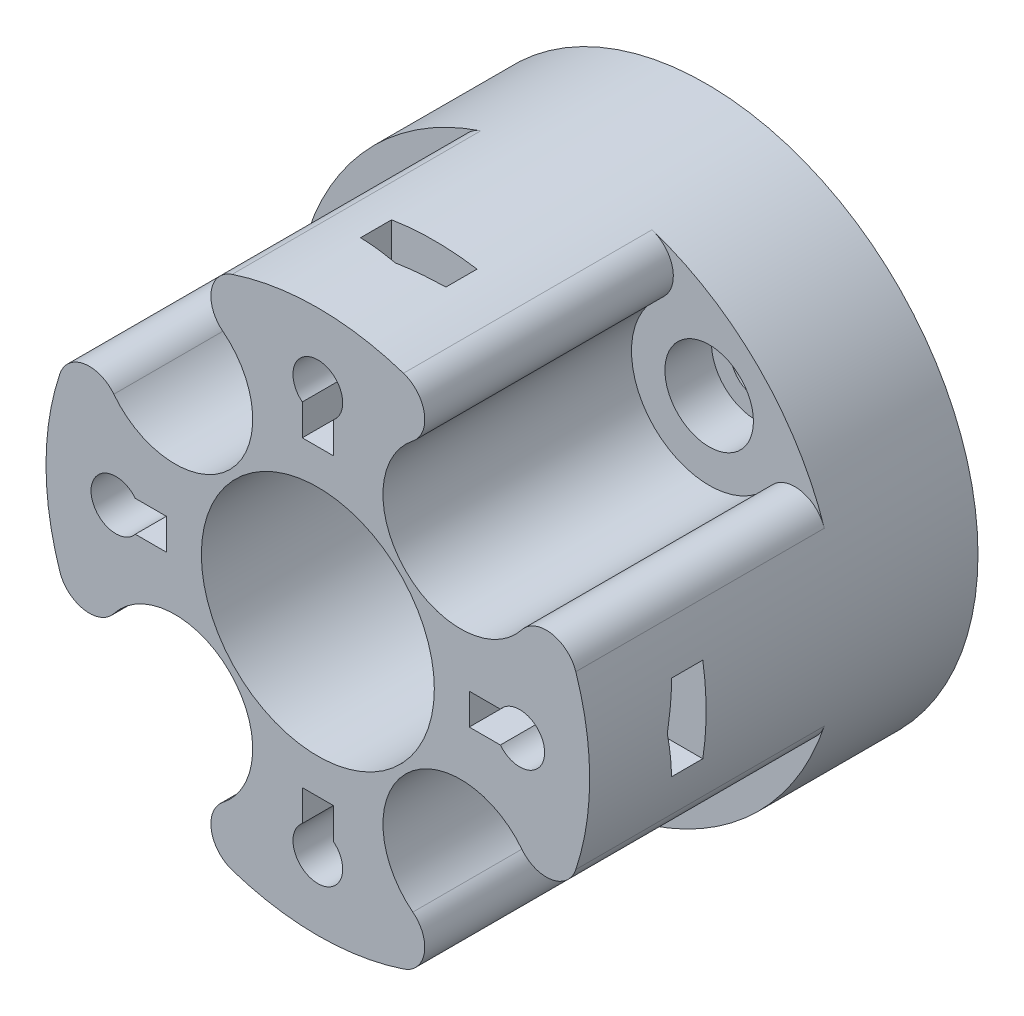
from build123d import *

# Parameters (mm, degrees)
SKETCH1_R           = 17.5
SKETCH1_R_2         = 2.85
BOSS_EXTRUDE1_DEPTH = 25
SKETCH1_3_R         = 2.85
SKETCH1_3_R_2       = 1.6
BOSS_EXTRUDE2_DEPTH = 6
SKETCH2_R           = 5
CUT_EXTRUDE1_DEPTH  = 16
FILLET1_R           = 2
CUT_EXTRUDE2_START  = -7.5
SKETCH3_R           = 1.6
CUT_EXTRUDE2_DEPTH  = 2.5
CUT_EXTRUDE3_START  = -10
SKETCH3_2_R         = 1.6
CUT_EXTRUDE3_DEPTH  = 10
CHAMFER1_SIZE       = 2.75
CHAMFER1_SIZE_2     = 0.5
SKETCH4_R           = 7.5
CUT_EXTRUDE4_DEPTH  = 36.178118369
CUT_EXTRUDE5_REACH  = 37.178
SKETCH5_W           = 2
SKETCH5_H           = 0.5
CIRPATTERN1_COUNT   = 4


with BuildPart() as part:
    # Sketch1 → Boss-Extrude1 (new body)
    with BuildSketch(Plane(origin=(0, 0, 0), x_dir=(0, 1, 0), z_dir=(0, 0, 1))):
        with Locations(Location((0, 0, 0), (0, 0, 270))):
            Circle(SKETCH1_R)
        with Locations(Location((-9.192388155, 9.192388155, 0), (0, 0, 270))):
            Circle(SKETCH1_R_2, mode=Mode.SUBTRACT)
        with Locations(Location((-9.192388155, -9.192388155, 0), (0, 0, 270))):
            Circle(SKETCH1_R_2, mode=Mode.SUBTRACT)
        with Locations(Location((9.192388155, -9.192388155, 0), (0, 0, 270))):
            Circle(SKETCH1_R_2, mode=Mode.SUBTRACT)
        with Locations(Location((9.192388155, 9.192388155, 0), (0, 0, 270))):
            Circle(SKETCH1_R_2, mode=Mode.SUBTRACT)
    extrude(amount=BOSS_EXTRUDE1_DEPTH)

    # Sketch1<3> → Boss-Extrude2 (add)
    # profile 1 of 4: a face of its own
    with BuildSketch(Plane(origin=(0, 0, 0), x_dir=(0, 1, 0), z_dir=(0, 0, 1))):
        with Locations(Location((-9.192388155, -9.192388155, 0), (0, 0, 270))):
            Circle(SKETCH1_3_R)
        with Locations(Location((-9.192388155, -9.192388155, 0), (0, 0, 270))):
            Circle(SKETCH1_3_R_2, mode=Mode.SUBTRACT)
    # profile 2 of 4: a face of its own
    with BuildSketch(Plane(origin=(0, 0, 0), x_dir=(0, 1, 0), z_dir=(0, 0, 1))):
        with Locations(Location((-9.192388155, 9.192388155, 0), (0, 0, 270))):
            Circle(SKETCH1_3_R)
        with Locations(Location((-9.192388155, 9.192388155, 0), (0, 0, 270))):
            Circle(SKETCH1_3_R_2, mode=Mode.SUBTRACT)
    # profile 3 of 4: a face of its own
    with BuildSketch(Plane(origin=(0, 0, 0), x_dir=(0, 1, 0), z_dir=(0, 0, 1))):
        with Locations(Location((9.192388155, -9.192388155, 0), (0, 0, 270))):
            Circle(SKETCH1_3_R)
        with Locations(Location((9.192388155, -9.192388155, 0), (0, 0, 270))):
            Circle(SKETCH1_3_R_2, mode=Mode.SUBTRACT)
    # profile 4 of 4: a face of its own
    with BuildSketch(Plane(origin=(0, 0, 0), x_dir=(0, 1, 0), z_dir=(0, 0, 1))):
        with Locations(Location((9.192388155, 9.192388155, 0), (0, 0, 270))):
            Circle(SKETCH1_3_R)
        with Locations(Location((9.192388155, 9.192388155, 0), (0, 0, 270))):
            Circle(SKETCH1_3_R_2, mode=Mode.SUBTRACT)
    extrude(amount=BOSS_EXTRUDE2_DEPTH)

    # Sketch2 → Cut-Extrude1 (cut)
    with BuildSketch(Plane.XY.offset(25)):
        with Locations((-9.192388155, 9.192388155)):
            Circle(SKETCH2_R)
        with Locations((9.192388155, 9.192388155)):
            Circle(SKETCH2_R)
        with Locations((9.192388155, -9.192388155)):
            Circle(SKETCH2_R)
        with Locations((-9.192388155, -9.192388155)):
            Circle(SKETCH2_R)
    extrude(amount=-CUT_EXTRUDE1_DEPTH, mode=Mode.SUBTRACT)

    # Fillet1
    fillet1_edges = [part.edges().sort_by_distance(p)[0] for p in [
        (-14.028560913, -10.46181049, 17),
        (-10.46181049, -14.028560913, 17),
        (10.46181049, -14.028560913, 17),
        (14.028560913, -10.46181049, 17),
        (14.028560913, 10.46181049, 17),
        (10.46181049, 14.028560913, 17),
        (-10.46181049, 14.028560913, 17),
        (-14.028560913, 10.46181049, 17),
    ]]
    fillet(fillet1_edges, radius=FILLET1_R)

    # Sketch3 → Cut-Extrude2 (cut)
    # profile 1 of 4: a face of its own
    with BuildSketch(Plane.XY.offset(25).offset(CUT_EXTRUDE2_START)):
        with BuildLine():
            Line((-2.75, 15.75), (-2.75, 17.282577933))
            ThreePointArc((-2.75, 17.282577933), (0, 17.5), (2.75, 17.282577933))
            Line((2.75, 17.282577933), (2.75, 15.75))
            Line((2.75, 15.75), (2.75, 10.25))
            Line((2.75, 10.25), (-2.75, 10.25))
            Line((-2.75, 10.25), (-2.75, 15.75))
        make_face()
        with Locations((0, 13)):
            Circle(SKETCH3_R, mode=Mode.SUBTRACT)
    # profile 2 of 4: a face of its own
    with BuildSketch(Plane.XY.offset(25).offset(CUT_EXTRUDE2_START)):
        with BuildLine():
            Line((15.75, -2.75), (10.25, -2.75))
            Line((10.25, -2.75), (10.25, 2.75))
            Line((10.25, 2.75), (15.75, 2.75))
            Line((15.75, 2.75), (17.282577933, 2.75))
            ThreePointArc((17.282577933, 2.75), (17.5, 0), (17.282577933, -2.75))
            Line((17.282577933, -2.75), (15.75, -2.75))
        make_face()
        with Locations((13, 0)):
            Circle(SKETCH3_R, mode=Mode.SUBTRACT)
    # profile 3 of 4: a face of its own
    with BuildSketch(Plane.XY.offset(25).offset(CUT_EXTRUDE2_START)):
        with BuildLine():
            Line((-2.75, -15.75), (-2.75, -10.25))
            Line((-2.75, -10.25), (2.75, -10.25))
            Line((2.75, -10.25), (2.75, -15.75))
            Line((2.75, -15.75), (2.75, -17.282577933))
            ThreePointArc((2.75, -17.282577933), (0, -17.5), (-2.75, -17.282577933))
            Line((-2.75, -17.282577933), (-2.75, -15.75))
        make_face()
        with Locations((0, -13)):
            Circle(SKETCH3_R, mode=Mode.SUBTRACT)
    # profile 4 of 4: a face of its own
    with BuildSketch(Plane.XY.offset(25).offset(CUT_EXTRUDE2_START)):
        with BuildLine():
            Line((-15.75, 2.75), (-10.25, 2.75))
            Line((-10.25, 2.75), (-10.25, -2.75))
            Line((-10.25, -2.75), (-15.75, -2.75))
            Line((-15.75, -2.75), (-17.282577933, -2.75))
            ThreePointArc((-17.282577933, -2.75), (-17.5, 0), (-17.282577933, 2.75))
            Line((-17.282577933, 2.75), (-15.75, 2.75))
        make_face()
        with Locations((-13, 0)):
            Circle(SKETCH3_R, mode=Mode.SUBTRACT)
    extrude(amount=CUT_EXTRUDE2_DEPTH, mode=Mode.SUBTRACT)

    # Sketch3<2> → Cut-Extrude3 (cut)
    with BuildSketch(Plane.XY.offset(25).offset(CUT_EXTRUDE3_START)):
        with Locations((-13, 0)):
            Circle(SKETCH3_2_R)
        with Locations((0, 13)):
            Circle(SKETCH3_2_R)
        with Locations((13, 0)):
            Circle(SKETCH3_2_R)
        with Locations((0, -13)):
            Circle(SKETCH3_2_R)
    extrude(amount=CUT_EXTRUDE3_DEPTH, mode=Mode.SUBTRACT)

    # Chamfer1
    # the kernel refuses this chamfer: 2.75, 0.5 mm, written as the material it adds along each edge
    with BuildSketch(Plane(origin=(-3.104266441, -2.75, 20), x_dir=(1.0355932807417332e-14, 0.9999763028084744, 0.006884317068104265), z_dir=(-1, 0, 0))) as chamfer1_piece_1_section:
        Polygon((CHAMFER1_SIZE * 0.999976302808, CHAMFER1_SIZE * 0.0068843170681), (-CHAMFER1_SIZE_2 * 0.0068843170681, CHAMFER1_SIZE_2 * 0.999976302808), (0, 0), align=None)
    chamfer1_piece_1 = extrude(amount=21.324045051, mode=Mode.PRIVATE)
    chamfer1_piece_1 = chamfer1_piece_1 & Plane(origin=(0, 0, 19.863927103), x_dir=(1, 0, 0), z_dir=(0, 0, -1)) * Cylinder(17.5, 54, mode=Mode.PRIVATE)
    chamfer1_piece_1 = chamfer1_piece_1 - Plane(origin=(-13, 0, 19.863927103), x_dir=(1, 0, 0), z_dir=(0, 0, -1)) * Cylinder(1.6, 54, mode=Mode.PRIVATE)
    add(chamfer1_piece_1)
    with BuildSketch(Plane(origin=(-24.428311492, 2.75, 20), x_dir=(2.1371797081769355e-15, 0.20388124945923355, -0.9789956262001082), z_dir=(1, 0, 0))) as chamfer1_piece_2_section:
        Polygon((CHAMFER1_SIZE_2 * 0.9789956262, -CHAMFER1_SIZE_2 * 0.203881249459), (-CHAMFER1_SIZE * 0.203881249459, -CHAMFER1_SIZE * 0.9789956262), (0, 0), align=None)
    chamfer1_piece_2 = extrude(amount=21.324045051, mode=Mode.PRIVATE)
    chamfer1_piece_2 = chamfer1_piece_2 & Plane(origin=(0, 0, 19.852070676), x_dir=(1, 0, 0), z_dir=(0, 0, -1)) * Cylinder(17.5, 54, mode=Mode.PRIVATE)
    chamfer1_piece_2 = chamfer1_piece_2 - Plane(origin=(-13, 0, 19.852070676), x_dir=(1, 0, 0), z_dir=(0, 0, -1)) * Cylinder(1.6, 54, mode=Mode.PRIVATE)
    add(chamfer1_piece_2)
    with BuildSketch(Plane(origin=(-2.75, 3.104266441, 20), x_dir=(0.9999763028084744, 0, 0.006884317068104265), z_dir=(0, 1, 0))) as chamfer1_piece_3_section:
        Polygon((CHAMFER1_SIZE * 0.999976302808, CHAMFER1_SIZE * 0.0068843170681), (-CHAMFER1_SIZE_2 * 0.0068843170681, CHAMFER1_SIZE_2 * 0.999976302808), (0, 0), align=None)
    chamfer1_piece_3 = extrude(amount=21.324045051, mode=Mode.PRIVATE)
    chamfer1_piece_3 = chamfer1_piece_3 & Plane(origin=(0, 0, 19.863927103), x_dir=(1, 0, 0), z_dir=(0, 0, -1)) * Cylinder(17.5, 54, mode=Mode.PRIVATE)
    chamfer1_piece_3 = chamfer1_piece_3 - Plane(origin=(0, 13, 19.863927103), x_dir=(1, 0, 0), z_dir=(0, 0, -1)) * Cylinder(1.6, 54, mode=Mode.PRIVATE)
    add(chamfer1_piece_3)
    with BuildSketch(Plane(origin=(2.75, 24.428311492, 20), x_dir=(0.20388124945923355, 0, -0.9789956262001082), z_dir=(0, -1, 0))) as chamfer1_piece_4_section:
        Polygon((CHAMFER1_SIZE_2 * 0.9789956262, -CHAMFER1_SIZE_2 * 0.203881249459), (-CHAMFER1_SIZE * 0.203881249459, -CHAMFER1_SIZE * 0.9789956262), (0, 0), align=None)
    chamfer1_piece_4 = extrude(amount=21.324045051, mode=Mode.PRIVATE)
    chamfer1_piece_4 = chamfer1_piece_4 & Plane(origin=(0, 0, 19.852070749), x_dir=(1, 0, 0), z_dir=(0, 0, -1)) * Cylinder(17.5, 54, mode=Mode.PRIVATE)
    chamfer1_piece_4 = chamfer1_piece_4 - Plane(origin=(0, 13, 19.852070749), x_dir=(1, 0, 0), z_dir=(0, 0, -1)) * Cylinder(1.6, 54, mode=Mode.PRIVATE)
    add(chamfer1_piece_4)
    with BuildSketch(Plane(origin=(3.104266441, 2.75, 20), x_dir=(-3.409880314637416e-15, -0.9999763028084744, 0.006884317068104265), z_dir=(1, 0, 0))) as chamfer1_piece_5_section:
        Polygon((CHAMFER1_SIZE * 0.999976302808, CHAMFER1_SIZE * 0.0068843170681), (-CHAMFER1_SIZE_2 * 0.0068843170681, CHAMFER1_SIZE_2 * 0.999976302808), (0, 0), align=None)
    chamfer1_piece_5 = extrude(amount=21.324045051, mode=Mode.PRIVATE)
    chamfer1_piece_5 = chamfer1_piece_5 & Plane(origin=(0, 0, 19.863927103), x_dir=(1, 0, 0), z_dir=(0, 0, -1)) * Cylinder(17.5, 54, mode=Mode.PRIVATE)
    chamfer1_piece_5 = chamfer1_piece_5 - Plane(origin=(13, 0, 19.863927103), x_dir=(1, 0, 0), z_dir=(0, 0, -1)) * Cylinder(1.6, 54, mode=Mode.PRIVATE)
    add(chamfer1_piece_5)
    with BuildSketch(Plane(origin=(24.428311492, -2.75, 20), x_dir=(3.409880314637416e-15, 0.9999763028084744, 0.006884317068104265), z_dir=(-1, 0, 0))) as chamfer1_piece_6_section:
        Polygon((CHAMFER1_SIZE * 0.999976302808, CHAMFER1_SIZE * 0.0068843170681), (-CHAMFER1_SIZE_2 * 0.0068843170681, CHAMFER1_SIZE_2 * 0.999976302808), (0, 0), align=None)
    chamfer1_piece_6 = extrude(amount=21.324045051, mode=Mode.PRIVATE)
    chamfer1_piece_6 = chamfer1_piece_6 & Plane(origin=(0, 0, 19.852070366), x_dir=(1, 0, 0), z_dir=(0, 0, -1)) * Cylinder(17.5, 54, mode=Mode.PRIVATE)
    chamfer1_piece_6 = chamfer1_piece_6 - Plane(origin=(13, 0, 19.852070366), x_dir=(1, 0, 0), z_dir=(0, 0, -1)) * Cylinder(1.6, 54, mode=Mode.PRIVATE)
    add(chamfer1_piece_6)
    with BuildSketch(Plane(origin=(2.75, -3.104266441, 20), x_dir=(-0.9999763028084744, 6.88290656102737e-15, 0.006884317068104265), z_dir=(0, -1, 0))) as chamfer1_piece_7_section:
        Polygon((CHAMFER1_SIZE * 0.999976302808, CHAMFER1_SIZE * 0.0068843170681), (-CHAMFER1_SIZE_2 * 0.0068843170681, CHAMFER1_SIZE_2 * 0.999976302808), (0, 0), align=None)
    chamfer1_piece_7 = extrude(amount=21.324045051, mode=Mode.PRIVATE)
    chamfer1_piece_7 = chamfer1_piece_7 & Plane(origin=(0, 0, 19.863927103), x_dir=(1, 0, 0), z_dir=(0, 0, -1)) * Cylinder(17.5, 54, mode=Mode.PRIVATE)
    chamfer1_piece_7 = chamfer1_piece_7 - Plane(origin=(0, -13, 19.863927103), x_dir=(1, 0, 0), z_dir=(0, 0, -1)) * Cylinder(1.6, 54, mode=Mode.PRIVATE)
    add(chamfer1_piece_7)
    with BuildSketch(Plane(origin=(-2.75, -24.428311492, 20), x_dir=(-0.20388124945923355, 1.4290779976363847e-15, -0.9789956262001082), z_dir=(0, 1, 0))) as chamfer1_piece_8_section:
        Polygon((CHAMFER1_SIZE_2 * 0.9789956262, -CHAMFER1_SIZE_2 * 0.203881249459), (-CHAMFER1_SIZE * 0.203881249459, -CHAMFER1_SIZE * 0.9789956262), (0, 0), align=None)
    chamfer1_piece_8 = extrude(amount=21.324045051, mode=Mode.PRIVATE)
    chamfer1_piece_8 = chamfer1_piece_8 & Plane(origin=(0, 0, 19.852070422), x_dir=(1, 0, 0), z_dir=(0, 0, -1)) * Cylinder(17.5, 54, mode=Mode.PRIVATE)
    chamfer1_piece_8 = chamfer1_piece_8 - Plane(origin=(0, -13, 19.852070422), x_dir=(1, 0, 0), z_dir=(0, 0, -1)) * Cylinder(1.6, 54, mode=Mode.PRIVATE)
    add(chamfer1_piece_8)

    # Sketch4 → Cut-Extrude4 (cut, through all)
    with BuildSketch(Plane.XY.offset(25)):
        Circle(SKETCH4_R)
    extrude(amount=-CUT_EXTRUDE4_DEPTH, mode=Mode.SUBTRACT)

    # Cut-Extrude5: up to this face of the body (flat: up to its plane)
    cut_extrude5_end = Plane(part.part.faces().sort_by_distance((-2.658998626, 13.766288966, 17.5))[0])
    # Sketch5 → Cut-Extrude5 (cut, up to the picked face)
    with BuildSketch(Plane.XY.offset(25), mode=Mode.PRIVATE) as cut_extrude5_sk1:
        with Locations((0, 10)):
            Rectangle(SKETCH5_W, SKETCH5_H)
    cut_extrude5_tool1 = split(extrude(cut_extrude5_sk1.sketch, amount=-CUT_EXTRUDE5_REACH, mode=Mode.PRIVATE), bisect_by=cut_extrude5_end, keep=Keep.BOTH, mode=Mode.PRIVATE)
    # Sketch5 → Cut-Extrude5 (cut, up to the picked face)
    with BuildSketch(Plane.XY.offset(25), mode=Mode.PRIVATE) as cut_extrude5_sk2:
        with BuildLine():
            ThreePointArc((1, 11.7510004), (0, 11.4), (-1, 11.7510004))
            Line((-1, 11.7510004), (-1, 10.25))
            Line((-1, 10.25), (1, 10.25))
            Line((1, 10.25), (1, 11.7510004))
        make_face()
    cut_extrude5_tool2 = split(extrude(cut_extrude5_sk2.sketch, amount=-CUT_EXTRUDE5_REACH, mode=Mode.PRIVATE), bisect_by=cut_extrude5_end, keep=Keep.BOTH, mode=Mode.PRIVATE)
    cut_extrude5_1 = cut_extrude5_tool1.solids().sort_by(Axis((0, 10, 25), (0, 0, -1)))[0]
    add(cut_extrude5_1, mode=Mode.SUBTRACT)
    cut_extrude5_2 = cut_extrude5_tool2.solids().sort_by(Axis((0, 10.884842, 25), (0, 0, -1)))[0]
    add(cut_extrude5_2, mode=Mode.SUBTRACT)
    cut_extrude5 = cut_extrude5_1 + cut_extrude5_2  # Cut-Extrude5 as one shape, for the pattern or mirror that repeats it

    # CirPattern1: Cut-Extrude5 ×4 about axis
    cirpattern1_axis = Axis((0, 0, 0), (0, 0, 1))
    for i in range(1, CIRPATTERN1_COUNT):
        add(cut_extrude5.rotate(cirpattern1_axis, i * 360 / CIRPATTERN1_COUNT), mode=Mode.SUBTRACT)


solid = part.part
